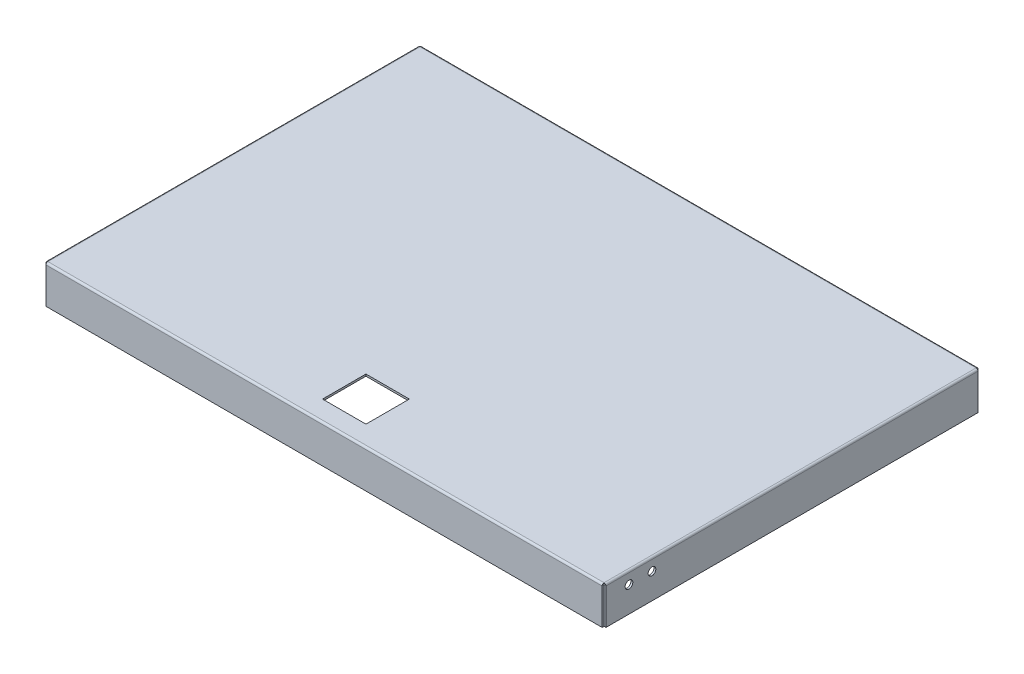
from build123d import *

# Parameters (mm, degrees)
SKETCH1_W                 = 3.175
SKETCH1_H                 = 615.95
SKIRT_DEPTH               = 59.4
SKETCH1_W_2               = 920.75
SKETCH1_H_2               = 3.175
SKIRT_2_DEPTH             = 59.4
SKIRT_3_DEPTH             = 59.4
SKIRT_4_DEPTH             = 59.4
TOP_SURFACE_DEPTH         = 3.175
FILLET1_R                 = 3.175
SCALE_HOLE_DEPTH          = 1114.942907817
SCALE_HOLE_DEPTH_BACK     = 1114.942907817
SKETCH3_W                 = 71.882
SKETCH3_H                 = 71.882
SKETCH4_R                 = 6.35
TETHER_AND_AIR_HOLE_DEPTH = 3.175


with BuildPart() as part:
    # Sketch1 → Skirt (new body)
    with BuildSketch(Plane(origin=(0, 0, 0), x_dir=(1, 0, 0), z_dir=(0, 1, 0))):
        with Locations((-1.5875, 307.975)):
            Rectangle(SKETCH1_W, SKETCH1_H)
    extrude(amount=SKIRT_DEPTH)

    # Sketch2 → Top Surface (add)
    with BuildSketch(Plane(origin=(0, 59.4, 0), x_dir=(1, 0, 0), z_dir=(0, 1, 0))):
        Polygon((-3.175, 0), (0, 0), (0, -3.175), (920.75, -3.175), (920.75, 0), (923.925, 0), (923.925, 615.95), (920.75, 615.95), (920.75, 619.125), (0, 619.125), (0, 615.95), (-3.175, 615.95), align=None)
    extrude(amount=TOP_SURFACE_DEPTH)

    # Fillet1
    fillet1_edges = [part.edges().sort_by_distance(p)[0] for p in [
        (923.925, 62.575, -307.975),
        (460.375, 62.575, -619.125),
        (460.375, 62.575, 3.175),
        (-3.175, 62.575, -307.975),
    ]]
    fillet(fillet1_edges, radius=FILLET1_R - 0.0001)  # a hair under: the kernel refuses the full size

    # Sketch3 → Scale Hole (cut, two sides: drawn at the far end of the back side and taken through both)
    with BuildSketch(Plane(origin=(0, 62.575, 0), x_dir=(1, 0, 0), z_dir=(0, 1, 0)).offset(-SCALE_HOLE_DEPTH_BACK)):
        with Locations((460.375, 66.167)):
            Rectangle(SKETCH3_W, SKETCH3_H)
    extrude(amount=SCALE_HOLE_DEPTH + SCALE_HOLE_DEPTH_BACK, mode=Mode.SUBTRACT)


with BuildPart() as body_2:
    # Sketch1 → Skirt 2 (new body)
    with BuildSketch(Plane(origin=(0, 0, 0), x_dir=(1, 0, 0), z_dir=(0, 1, 0))):
        with Locations((460.375, -1.5875)):
            Rectangle(SKETCH1_W_2, SKETCH1_H_2)
    extrude(amount=SKIRT_2_DEPTH)


with BuildPart() as body_3:
    # Sketch1 → Skirt 3 (new body)
    with BuildSketch(Plane(origin=(0, 0, 0), x_dir=(1, 0, 0), z_dir=(0, 1, 0))):
        with Locations((460.375, 617.5375)):
            Rectangle(SKETCH1_W_2, SKETCH1_H_2)
    extrude(amount=SKIRT_3_DEPTH)


with BuildPart() as body_4:
    # Sketch1 → Skirt 4 (new body)
    with BuildSketch(Plane(origin=(0, 0, 0), x_dir=(1, 0, 0), z_dir=(0, 1, 0))):
        with Locations((922.3375, 307.975)):
            Rectangle(SKETCH1_W, SKETCH1_H)
    extrude(amount=SKIRT_4_DEPTH)

    # Sketch4 → Tether and Air Hole (cut)
    with BuildSketch(Plane(origin=(923.925, 0, 0), x_dir=(0, 0, -1), z_dir=(1, 0, 0))):
        with Locations((38.1, 42.4)):
            Circle(SKETCH4_R)
        with Locations((76.2, 42.4)):
            Circle(SKETCH4_R)
    extrude(amount=-TETHER_AND_AIR_HOLE_DEPTH, mode=Mode.SUBTRACT)


solid = Compound([part.part, body_2.part, body_3.part, body_4.part])
